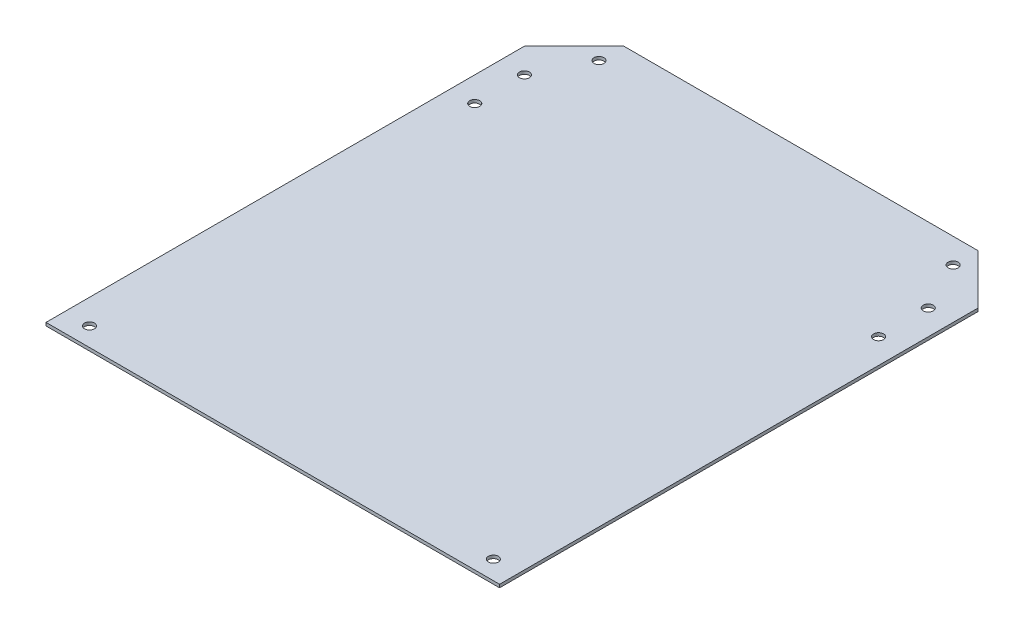
from build123d import *

# Parameters (mm, degrees)
BOSS_EXTRUDE1_DEPTH    = 1.5875
F_10_CLEARANCE_HOLE1_D = 5.1054


with BuildPart() as part:
    # Sketch3 → Boss-Extrude1 (new body)
    with BuildSketch(Plane(origin=(0, 0, 0), x_dir=(1, 0, 0), z_dir=(0, 1, 0))):
        Polygon((-96.156504661, -3.621535329), (-96.156504661, 240.853464668), (-70.756504733, 266.253464671), (110.218495843, 266.253464671), (135.618495843, 240.853464668), (135.618495843, -3.621535329), align=None)
    extrude(amount=BOSS_EXTRUDE1_DEPTH)

    # #10 Clearance Hole1 (through all)
    with Locations(Plane(origin=(0, 1.5875, 0), x_dir=(1, 0, 0), z_dir=(0, 1, 0))):
        with Locations((-83.456504661, -25.846534824), (-83.456504661, 202.753465684), (-83.456504661, 228.153465684), (-70.756504661, 253.553465684), (122.918495843, 202.753464668), (122.918495843, 228.153464668), (110.218495843, 253.553464668), (-83.456504661, 5.903465176), (122.918495843, 5.903465176)):
            Hole(F_10_CLEARANCE_HOLE1_D / 2)


solid = part.part
